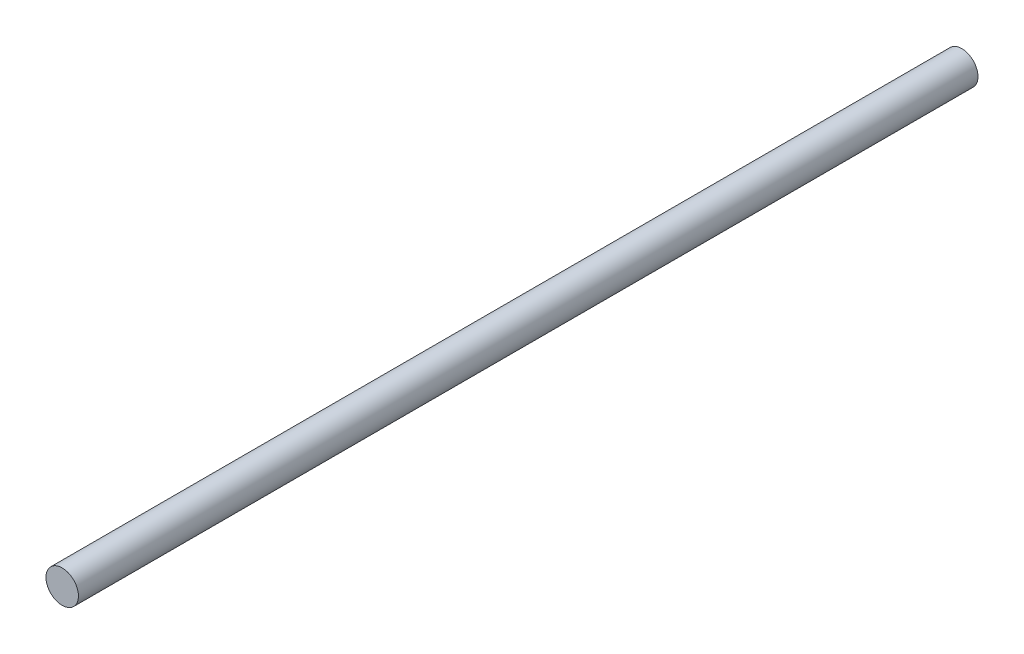
from build123d import *

# Parameters (mm, degrees)
SKETCH1_R           = 3.25
BOSS_EXTRUDE1_DEPTH = 180


with BuildPart() as part:
    # Sketch1 → Boss-Extrude1 (new body)
    with BuildSketch(Plane.XY):
        Circle(SKETCH1_R)
    extrude(amount=BOSS_EXTRUDE1_DEPTH)


solid = part.part
